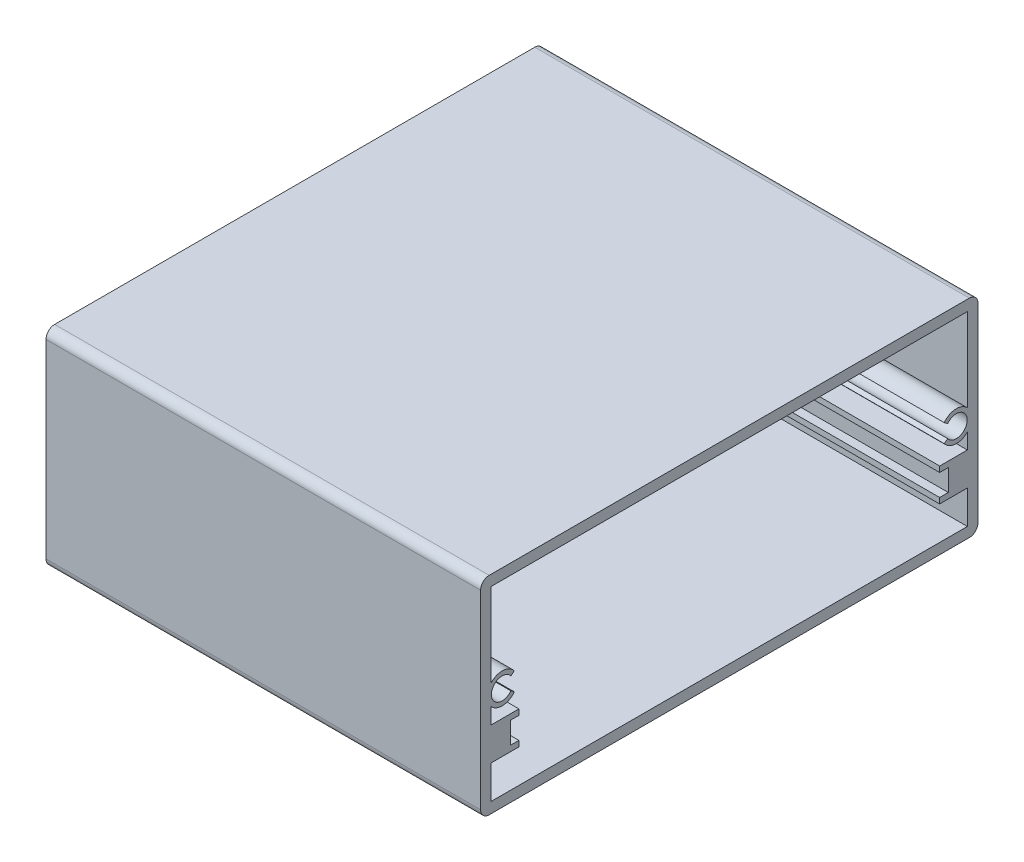
from build123d import *

# Parameters (mm, degrees)
SKETCH1_W           = 57.46
SKETCH1_H           = 23.96
BOSS_EXTRUDE1_DEPTH = 50.2
FILLET1_R           = 1


with BuildPart() as part:
    # Sketch1 → Boss-Extrude1 (new body)
    with BuildSketch(Plane(origin=(0, 0, 0), x_dir=(0, 0, -1), z_dir=(1, 0, 0))):
        Rectangle(SKETCH1_W, SKETCH1_H)
        with BuildLine():
            Line((-27.5, 1.123993355), (-27.5, 10.75))
            Line((-27.5, 10.75), (27.5, 10.75))
            Line((27.5, 10.75), (27.5, 1.123993355))
            ThreePointArc((27.5, 1.123993355), (26.129235481, 1.667096595), (24.83, 0.97))
            Line((24.83, 0.97), (25.23, 0.67))
            ThreePointArc((25.23, 0.67), (27.48, -0.08), (25.23, -0.83))
            Line((25.23, -0.83), (24.83, -1.13))
            ThreePointArc((24.83, -1.13), (26.129235481, -1.827096595), (27.5, -1.283993355))
            Line((27.5, -1.283993355), (27.5, -3.1))
            Line((27.5, -3.1), (24.3, -3.1))
            Line((24.3, -3.1), (24.3, -3.75))
            Line((24.3, -3.75), (25.3, -3.75))
            Line((25.3, -3.75), (25.3, -6.25))
            Line((25.3, -6.25), (24.3, -6.25))
            Line((24.3, -6.25), (24.3, -6.9))
            Line((24.3, -6.9), (27.5, -6.9))
            Line((27.5, -6.9), (27.5, -10.75))
            Line((27.5, -10.75), (-27.5, -10.75))
            Line((-27.5, -10.75), (-27.5, -6.9))
            Line((-27.5, -6.9), (-24.3, -6.9))
            Line((-24.3, -6.9), (-24.3, -6.25))
            Line((-24.3, -6.25), (-25.3, -6.25))
            Line((-25.3, -6.25), (-25.3, -3.75))
            Line((-25.3, -3.75), (-24.3, -3.75))
            Line((-24.3, -3.75), (-24.3, -3.1))
            Line((-24.3, -3.1), (-27.5, -3.1))
            Line((-27.5, -3.1), (-27.5, -1.283993355))
            ThreePointArc((-27.5, -1.283993355), (-26.129235481, -1.827096595), (-24.83, -1.13))
            Line((-24.83, -1.13), (-25.23, -0.83))
            ThreePointArc((-25.23, -0.83), (-27.48, -0.08), (-25.23, 0.67))
            Line((-25.23, 0.67), (-24.83, 0.97))
            ThreePointArc((-24.83, 0.97), (-26.129235481, 1.667096595), (-27.5, 1.123993355))
        make_face(mode=Mode.SUBTRACT)
    extrude(amount=BOSS_EXTRUDE1_DEPTH)

    # Fillet1
    fillet1_edges = [part.edges().sort_by_distance(p)[0] for p in [
        (25.1, -11.98, -28.73),
        (25.1, 11.98, -28.73),
        (25.1, -11.98, 28.73),
        (25.1, 11.98, 28.73),
    ]]
    fillet(fillet1_edges, radius=FILLET1_R)


solid = part.part
